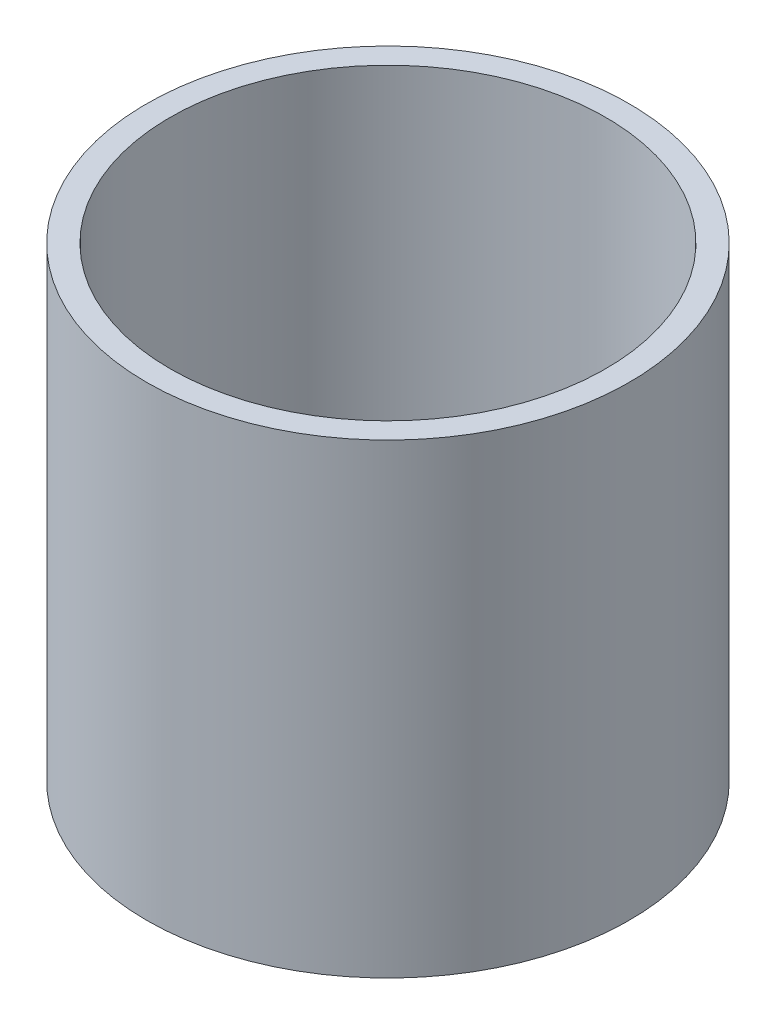
from build123d import *

# Parameters (mm, degrees)
SKETCH1_R           = 42.5
BOSS_EXTRUDE1_DEPTH = 82.047997228
SKETCH2_R           = 38.356586565
CUT_EXTRUDE1_DEPTH  = 102.707294966


with BuildPart() as part:
    # Sketch1 → Boss-Extrude1 (new body)
    with BuildSketch(Plane(origin=(0, 0, 0), x_dir=(1, 0, 0), z_dir=(0, 1, 0))):
        Circle(SKETCH1_R)
    extrude(amount=BOSS_EXTRUDE1_DEPTH)

    # Sketch2 → Cut-Extrude1 (cut, through all)
    with BuildSketch(Plane(origin=(0, 0, 0), x_dir=(1, 0, 0), z_dir=(0, 1, 0))):
        Circle(SKETCH2_R)
    extrude(amount=CUT_EXTRUDE1_DEPTH, mode=Mode.SUBTRACT)


solid = part.part
